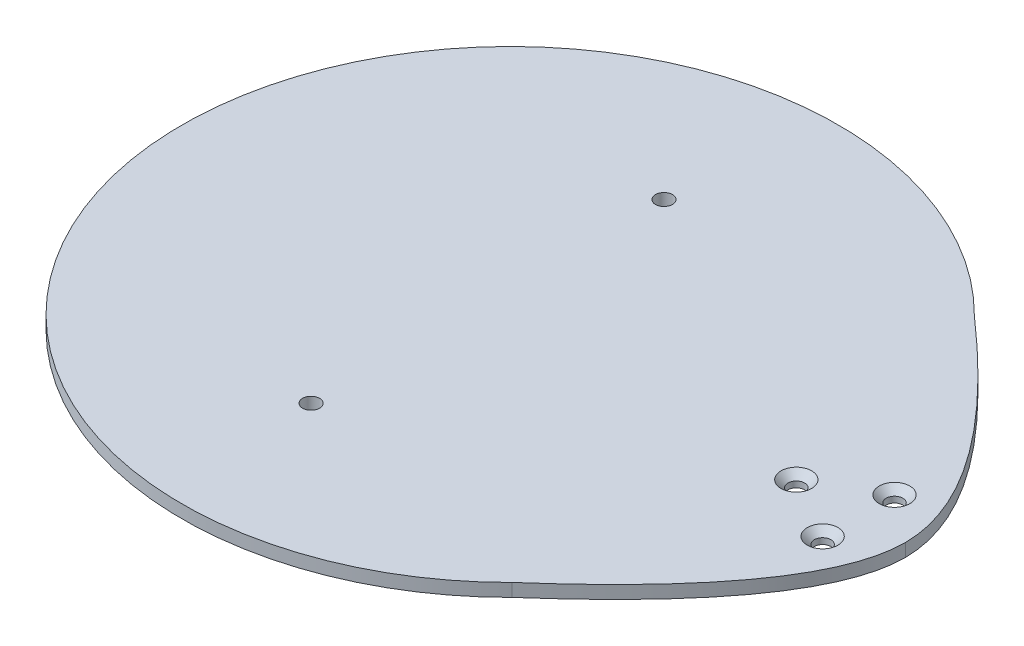
from build123d import *

# Parameters (mm, degrees)
AUFSATZ_LINEAR_AUSTRAGEN1_DEPTH = 2.5
SKIZZE2_R                       = 1.6
SCHNITT_LINEAR_AUSTRAGEN1_DEPTH = 102.387999648
FASE1_SIZE                      = 1.35
SKIZZE3_R                       = 1.65
SCHNITT_LINEAR_AUSTRAGEN2_DEPTH = 102.387999648


with BuildPart() as part:
    # Skizze1 → Aufsatz-Linear austragen1 (new body)
    with BuildSketch(Plane(origin=(0, 0, 0), x_dir=(1, 0, 0), z_dir=(0, 1, 0))):
        with BuildLine():
            ThreePointArc((28.970752729, 44.527564532), (-79.200181402, 0.000357393), (28.970752729, -44.526849746))
            Line((28.970752729, -44.526849746), (28.970752729, -44.530261837))
            add(Edge.make_bspline(
                [(28.970752729, -44.530261837), (60.189363801, -17.15173776), (60.189363801, 17.149040455), (28.970752729, 44.527564532)],
                knots=[0, 0, 0, 1, 2, 2, 2], degree=2))
        make_face()
    extrude(amount=AUFSATZ_LINEAR_AUSTRAGEN1_DEPTH)

    # Skizze2 → Schnitt-Linear austragen1 (cut, through all)
    with BuildSketch(Plane(origin=(0, 2.5, 0), x_dir=(1, 0, 0), z_dir=(0, 1, 0))):
        with Locations((51.189363801, 6.926854578)):
            Circle(SKIZZE2_R)
        with Locations((39.189363801, -0.001348653)):
            Circle(SKIZZE2_R)
        with Locations((51.189363801, -6.929551883)):
            Circle(SKIZZE2_R)
    extrude(amount=-SCHNITT_LINEAR_AUSTRAGEN1_DEPTH, mode=Mode.SUBTRACT)

    # Fase1
    fase1_edges = [part.edges().sort_by_distance(p)[0] for p in [
        (49.589363801, 2.5, 6.929551883),
        (37.589363801, 2.5, 0.001348653),
        (49.589363801, 2.5, -6.926854578),
    ]]
    chamfer(fase1_edges, length=FASE1_SIZE)

    # Skizze3 → Schnitt-Linear austragen2 (cut, through all)
    with BuildSketch(Plane(origin=(0, 2.5, 0), x_dir=(1, 0, 0), z_dir=(0, 1, 0))):
        with Locations((-20.310636199, 33.998651347)):
            Circle(SKIZZE3_R)
        with Locations((-20.310636199, -34.001348653)):
            Circle(SKIZZE3_R)
    extrude(amount=-SCHNITT_LINEAR_AUSTRAGEN2_DEPTH, mode=Mode.SUBTRACT)


solid = part.part
